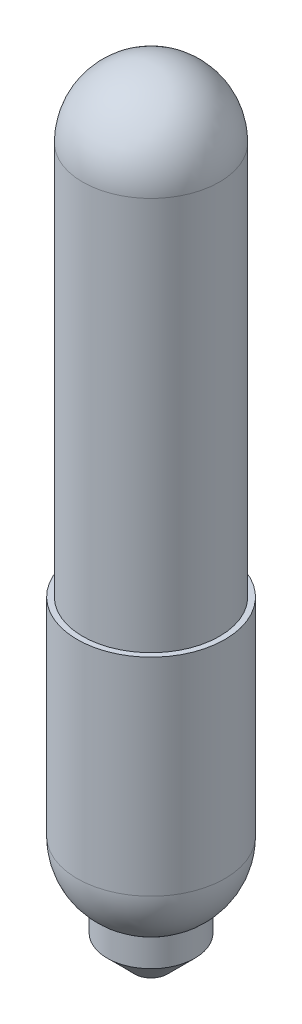
from build123d import *

# Parameters (mm, degrees)
FILLET1_R     = 1.5875
CHAMFER1_SIZE = 0.635


with BuildPart() as part:
    # Sketch1 → Revolve1 (revolve)
    with BuildSketch(Plane.XY):
        Polygon((0, 0), (1.016, 0), (1.016, 1.27), (1.7145, 1.27), (1.7145, 7.3914), (1.5875, 7.3914), (1.5875, 18.1102), (0, 18.1102), align=None)
    revolve(axis=Axis((0, 0, 0), (0, 1, 0)))

    # Fillet1
    # the kernel refuses this fillet: 1.5875 mm, written as the material it takes off along each edge
    with BuildSketch(Plane(origin=(0, 18.1102, 0), x_dir=(1, 0, 0), z_dir=(0, 0, 1))) as fillet1_piece_1:
        with BuildLine():
            CenterArc((1.5875 - FILLET1_R, -FILLET1_R), FILLET1_R, 0, 90)
            Line((1.5875 - FILLET1_R, 0), (1.5875 - FILLET1_R, FILLET1_R * 0.02))
            Line((1.5875 - FILLET1_R, FILLET1_R * 0.02), (1.5875, FILLET1_R * 0.02))
            Line((1.5875, FILLET1_R * 0.02), (1.5875 + FILLET1_R * 0.02, 0))
            Line((1.5875 + FILLET1_R * 0.02, 0), (1.5875 + FILLET1_R * 0.02, -FILLET1_R))
            Line((1.5875 + FILLET1_R * 0.02, -FILLET1_R), (1.5875, -FILLET1_R))
        make_face()
    revolve(axis=Axis((0, 18.1102, 0), (0, 1, 0)), mode=Mode.SUBTRACT)
    with BuildSketch(Plane(origin=(0, 1.27, 0), x_dir=(1, 0, 0), z_dir=(0, 0, 1))) as fillet1_piece_2:
        with BuildLine():
            CenterArc((0.127, 1.315232014), FILLET1_R, 304.055797743, 55.944202257)
            Line((1.7145, 1.315232014), (1.74625, 1.315232014))
            Line((1.74625, 1.315232014), (1.74625, 0))
            Line((1.74625, 0), (1.7145, -0.03175))
            ThreePointArc((1.7145, -0.03175), (1.36525, -0.03175), (1.03378, -0.02630464))
            Line((1.03378, -0.02630464), (1.016, 0))
        make_face()
    revolve(axis=Axis((0, 1.27, 0), (0, 1, 0)), mode=Mode.SUBTRACT)

    # Chamfer1
    chamfer1_edges = [part.edges().sort_by_distance(p)[0] for p in [
        (-1.016, 0, 0),
    ]]
    chamfer(chamfer1_edges, length=CHAMFER1_SIZE)


solid = part.part
